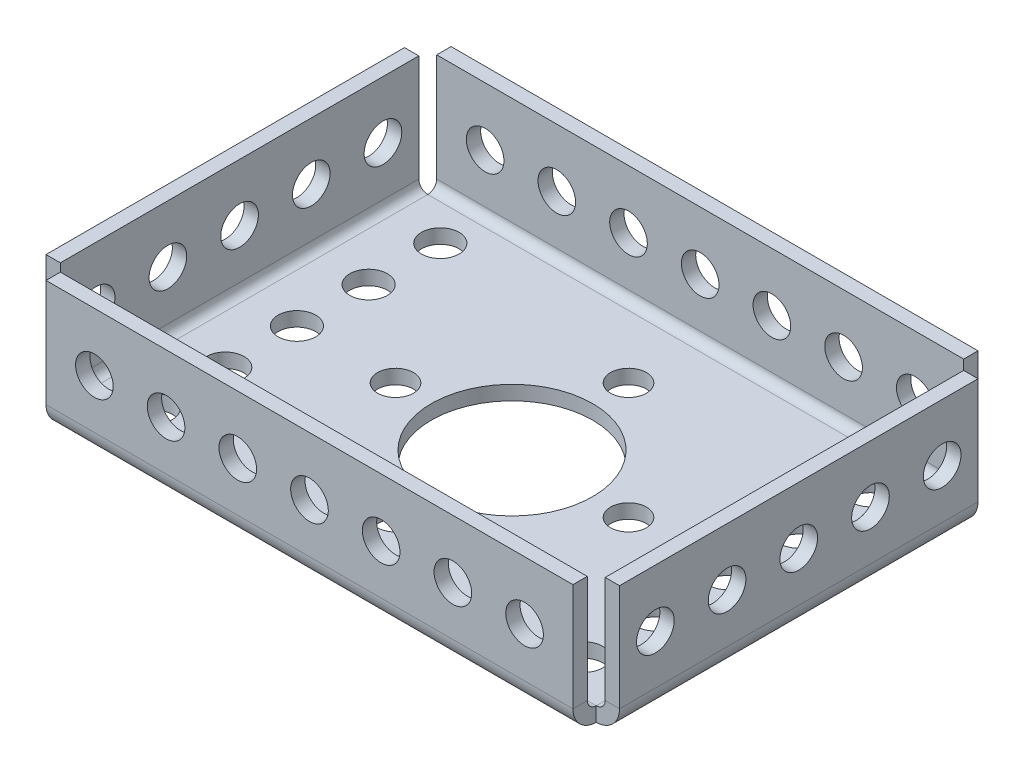
from build123d import *

# Parameters (mm, degrees)
SKETCH1_W                      = 64
SKETCH1_H                      = 40
BOSS_EXTRUDE1_DEPTH            = 1.6
SKETCH2_R                      = 2.1
CUT_EXTRUDE1_DEPTH             = 76.488807117
LPATTERN1_COUNT                = 2
LPATTERN1_PITCH                = 48
LPATTERN1_COUNT_DIR2           = 5
LPATTERN1_PITCH_DIR2           = 8
EDGE_FLANGE1_STRIP_W           = 8.4
EDGE_FLANGE1_STRIP_H           = 1.6
EDGE_FLANGE1_STRIP_CUT_DEPTH   = 40
EDGE_FLANGE1_STRIP_2_W         = 8.4
EDGE_FLANGE1_STRIP_2_H         = 1.6
EDGE_FLANGE1_STRIP_CUT_2_DEPTH = 40
EDGE_FLANGE1_DEPTH             = 40
EDGE_FLANGE1_BEND_DEPTH        = 40
SKETCH14_R                     = 2.1
CUT_EXTRUDE2_DEPTH             = 77.852130745
LPATTERN2_COUNT                = 5
LPATTERN2_PITCH                = 8
EDGE_FLANGE2_DEPTH             = 58.8
EDGE_FLANGE2_BEND_DEPTH        = 58.8
SKETCH25_R                     = 2.1
CUT_EXTRUDE3_DEPTH             = 80.700690085
LPATTERN3_COUNT                = 7
LPATTERN3_PITCH                = 8
SKETCH26_R                     = 9
SKETCH26_R_2                   = 2
CUT_EXTRUDE4_DEPTH             = 79.255479041


# Sheet-metal steps are written as plain solids
with BuildPart() as part:
    # Sketch1 → Boss-Extrude1 (new body)
    with BuildSketch(Plane(origin=(0, 0, 0), x_dir=(1, 0, 0), z_dir=(0, 1, 0))):
        with Locations((32, -20)):
            Rectangle(SKETCH1_W, SKETCH1_H)
    extrude(amount=BOSS_EXTRUDE1_DEPTH)

    # Sketch2 → Cut-Extrude1 (cut, through all)
    with BuildSketch(Plane(origin=(0, 1.6, 0), x_dir=(1, 0, 0), z_dir=(0, 1, 0))):
        with Locations(Location((8, -4, 0), (0, 0, 270))):
            Circle(SKETCH2_R)
    cut_extrude1 = extrude(amount=-CUT_EXTRUDE1_DEPTH, mode=Mode.SUBTRACT)

    # LPattern1: Cut-Extrude1 2 × 5
    with Locations(*[(i * LPATTERN1_PITCH, 0, j * LPATTERN1_PITCH_DIR2) for i in range(LPATTERN1_COUNT) for j in range(LPATTERN1_COUNT_DIR2) if (i, j) != (0, 0)]):
        add(cut_extrude1, mode=Mode.SUBTRACT)

    # Edge-Flange1 strip (across the edge) → Edge-Flange1 strip cut (cut)
    with BuildSketch(Plane(origin=(64, 1.6, 40), x_dir=(-1, 0, 0), z_dir=(0, 0, -1))):
        with Locations((-1.6, -0.8)):
            Rectangle(EDGE_FLANGE1_STRIP_W, EDGE_FLANGE1_STRIP_H)
    extrude(amount=EDGE_FLANGE1_STRIP_CUT_DEPTH, mode=Mode.SUBTRACT)

    # Edge-Flange1 strip 2 (across the edge) → Edge-Flange1 strip cut 2 (cut)
    with BuildSketch(Plane(origin=(0, 1.6, 0), x_dir=(1, 0, 0), z_dir=(0, 0, 1))):
        with Locations((-1.6, -0.8)):
            Rectangle(EDGE_FLANGE1_STRIP_2_W, EDGE_FLANGE1_STRIP_2_H)
    extrude(amount=EDGE_FLANGE1_STRIP_CUT_2_DEPTH, mode=Mode.SUBTRACT)

    # Edge-Flange1 section (across the edge) → Edge-Flange1 (add)
    with BuildSketch(Plane(origin=(64, 1.6, 40), x_dir=(-1, 0, 0), z_dir=(0, 0, -1))):
        with BuildLine():
            Line((0, 1), (0, 12.9))
            Line((0, 12.9), (1.6, 12.9))
            Line((1.6, 12.9), (1.6, 1))
            ThreePointArc((1.6, 1), (1.892893219, 0.292893219), (2.6, 0))
            Line((2.6, 0), (2.6, -1.6))
            ThreePointArc((2.6, -1.6), (0.761522369, -0.838477631), (0, 1))
        make_face()
    extrude(amount=EDGE_FLANGE1_DEPTH)

    # Edge-Flange1 section 2 (across the edge) → Edge-Flange1 bend (add)
    with BuildSketch(Plane(origin=(0, 1.6, 0), x_dir=(1, 0, 0), z_dir=(0, 0, 1))):
        with BuildLine():
            Line((0, 1), (0, 12.9))
            Line((0, 12.9), (1.6, 12.9))
            Line((1.6, 12.9), (1.6, 1))
            ThreePointArc((1.6, 1), (1.892893219, 0.292893219), (2.6, 0))
            Line((2.6, 0), (2.6, -1.6))
            ThreePointArc((2.6, -1.6), (0.761522369, -0.838477631), (0, 1))
        make_face()
    extrude(amount=EDGE_FLANGE1_BEND_DEPTH)

    # Sketch14 → Cut-Extrude2 (cut, through all)
    with BuildSketch(Plane.ZY):
        with Locations(Location((4, 8.1, 0), (0, 0, 270))):
            Circle(SKETCH14_R)
    cut_extrude2 = extrude(amount=-CUT_EXTRUDE2_DEPTH, mode=Mode.SUBTRACT)

    # LPattern2: Cut-Extrude2 ×5
    with Locations(*[(0, 0, i * LPATTERN2_PITCH) for i in range(1, LPATTERN2_COUNT)]):
        add(cut_extrude2, mode=Mode.SUBTRACT)

    # Edge-Flange2 section (across the edge) → Edge-Flange2 (add)
    with BuildSketch(Plane(origin=(2.6, 1.6, 41), x_dir=(0, 0, -1), z_dir=(1, 0, 0))):
        with BuildLine():
            Line((-1.6, 1), (-1.6, 13))
            Line((-1.6, 13), (0, 13))
            Line((0, 13), (0, 1))
            ThreePointArc((0, 1), (0.292893219, 0.292893219), (1, 0))
            Line((1, 0), (1, -1.6))
            ThreePointArc((1, -1.6), (-0.838477631, -0.838477631), (-1.6, 1))
        make_face()
    extrude(amount=EDGE_FLANGE2_DEPTH)

    # Edge-Flange2 section 2 (across the edge) → Edge-Flange2 bend (add)
    with BuildSketch(Plane(origin=(61.4, 1.6, -1), x_dir=(0, 0, 1), z_dir=(-1, 0, 0))):
        with BuildLine():
            Line((-1.6, 1), (-1.6, 13))
            Line((-1.6, 13), (0, 13))
            Line((0, 13), (0, 1))
            ThreePointArc((0, 1), (0.292893219, 0.292893219), (1, 0))
            Line((1, 0), (1, -1.6))
            ThreePointArc((1, -1.6), (-0.838477631, -0.838477631), (-1.6, 1))
        make_face()
    extrude(amount=EDGE_FLANGE2_BEND_DEPTH)

    # Sketch25 → Cut-Extrude3 (cut, through all)
    with BuildSketch(Plane(origin=(0, 0, -2.6), x_dir=(-1, 0, 0), z_dir=(0, 0, -1))):
        with Locations((-8, 8.1)):
            Circle(SKETCH25_R)
    cut_extrude3 = extrude(amount=-CUT_EXTRUDE3_DEPTH, mode=Mode.SUBTRACT)

    # LPattern3: Cut-Extrude3 ×7
    with Locations(*[(i * LPATTERN3_PITCH, 0, 0) for i in range(1, LPATTERN3_COUNT)]):
        add(cut_extrude3, mode=Mode.SUBTRACT)

    # Sketch26 → Cut-Extrude4 (cut, through all)
    with BuildSketch(Plane.XZ):
        with Locations(Location((32, 20, 0), (0, 0, 270))):
            Circle(SKETCH26_R)
        with Locations(Location((45, 20, 0), (0, 0, 270))):
            Circle(SKETCH26_R_2)
        with Locations(Location((32, 7, 0), (0, 0, 270))):
            Circle(SKETCH26_R_2)
        with Locations(Location((19, 20, 0), (0, 0, 270))):
            Circle(SKETCH26_R_2)
        with Locations(Location((32, 33, 0), (0, 0, 270))):
            Circle(SKETCH26_R_2)
    extrude(amount=-CUT_EXTRUDE4_DEPTH, mode=Mode.SUBTRACT)


solid = part.part
